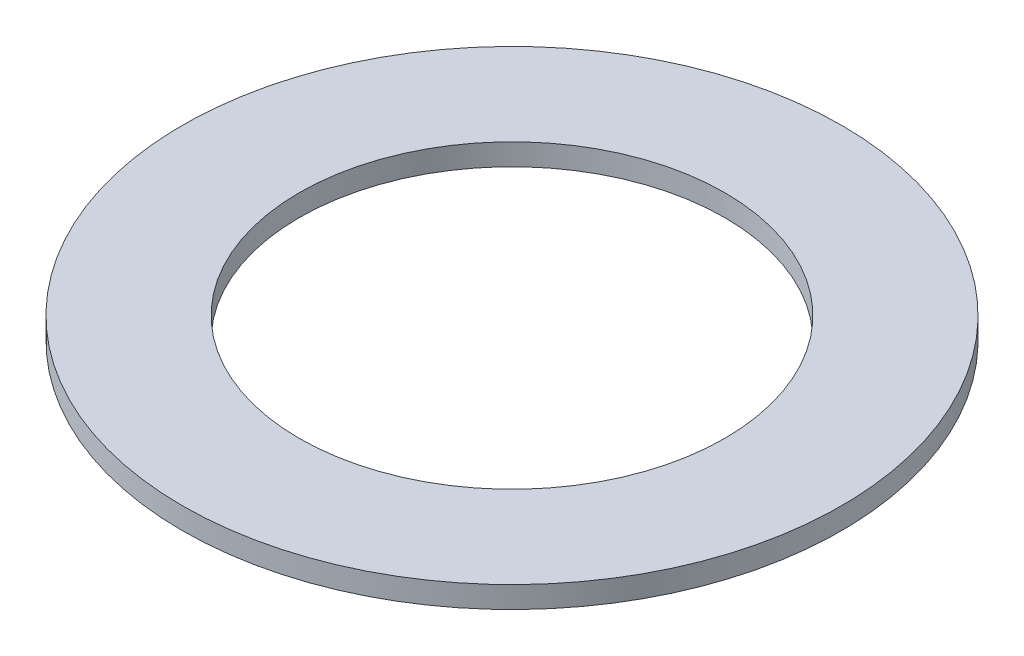
from build123d import *

# Parameters (mm, degrees)
SKETCH1_R           = 76.2
SKETCH1_R_2         = 49.2
BOSS_EXTRUDE1_DEPTH = 5


with BuildPart() as part:
    # Sketch1 → Boss-Extrude1 (new body)
    with BuildSketch(Plane(origin=(0, 0, 0), x_dir=(1, 0, 0), z_dir=(0, 1, 0))):
        Circle(SKETCH1_R)
        Circle(SKETCH1_R_2, mode=Mode.SUBTRACT)
    extrude(amount=BOSS_EXTRUDE1_DEPTH)


solid = part.part
